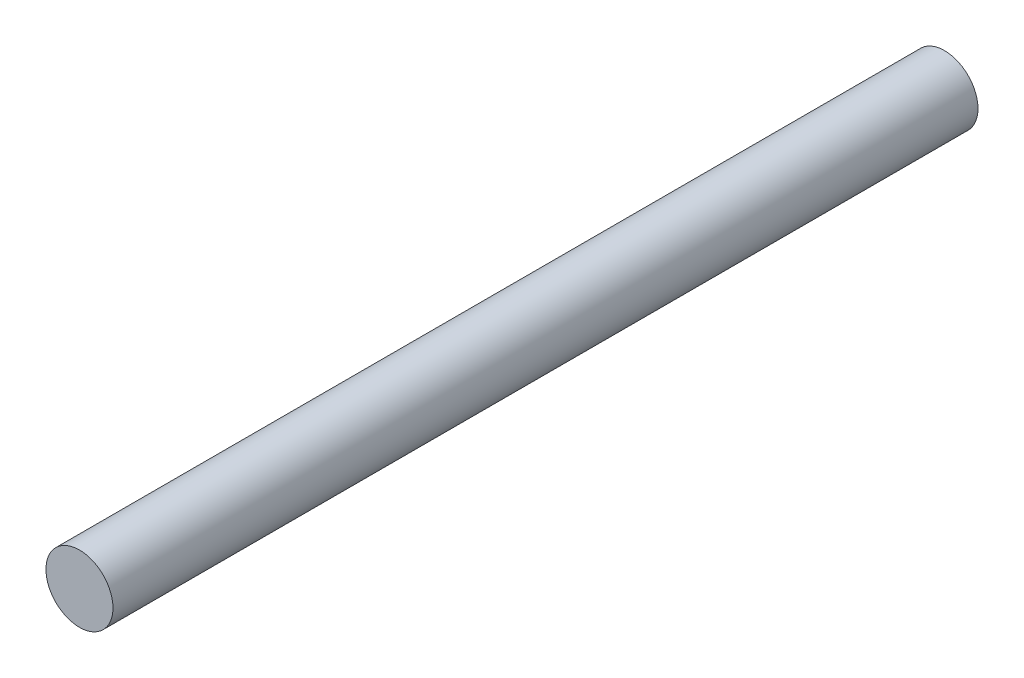
from build123d import *

# Parameters (mm, degrees)
SKETCH2_R           = 3.875
BOSS_EXTRUDE1_DEPTH = 100


with BuildPart() as part:
    # Sketch2 → Boss-Extrude1 (new body)
    with BuildSketch(Plane.XY):
        Circle(SKETCH2_R)
    extrude(amount=BOSS_EXTRUDE1_DEPTH)


solid = part.part
